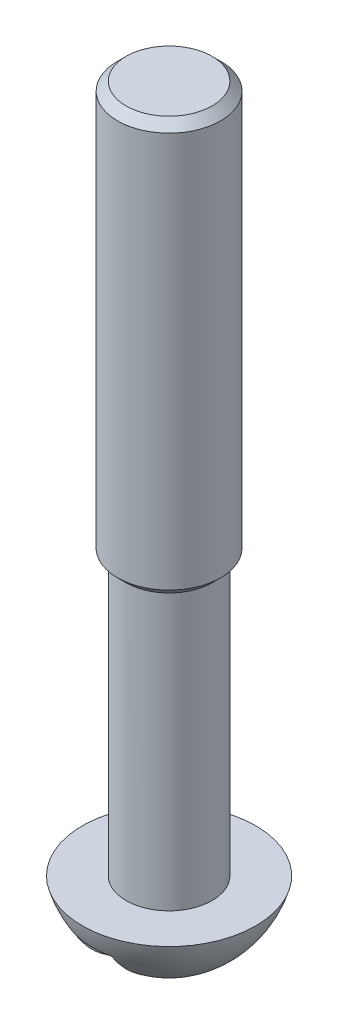
from build123d import *

# Parameters (mm, degrees)
SKETCH1_R               = 1.5
BOSS_EXTRUDE1_DEPTH     = 20
CUT_EXTRUDE1_DEPTH      = 21.315038789
CUT_EXTRUDE1_DEPTH_BACK = 21.315038789
SKETCH4_R               = 2.52
SKETCH4_R_2             = 1.25
CUT_EXTRUDE2_DEPTH      = 8
CHAMFER1_SIZE           = 0.25


with BuildPart() as part:
    # Sketch1 → Boss-Extrude1 (new body)
    with BuildSketch(Plane(origin=(0, 0, 0), x_dir=(1, 0, 0), z_dir=(0, 1, 0))):
        with Locations(Location((0, 0, 0), (0, 0, 270))):
            Circle(SKETCH1_R)
    extrude(amount=BOSS_EXTRUDE1_DEPTH)

    # Sketch2 → Revolve1 (revolve)
    with BuildSketch(Plane.XY, mode=Mode.PRIVATE) as revolve1_sk:
        with BuildLine():
            Line((0, 0), (-2.52, 0))
            ThreePointArc((-2.52, 0), (-1.585449748, -1.440539697), (0, -2.1))
            Line((0, -2.1), (0, 0))
        make_face()
    revolve(revolve1_sk.sketch.rotate(Axis((0, -2.1, 0), (0, 1, 0)), 180), axis=Axis((0, -2.1, 0), (0, 1, 0)))

    # Sketch3 → Cut-Extrude1 (cut, two sides: drawn at the far end of the back side and taken through both)
    with BuildSketch(Plane.XY.offset(-CUT_EXTRUDE1_DEPTH_BACK)):
        Polygon((-0.5, -0.7), (0, -0.7), (0.5, -0.7), (0.5, -4.6380618), (-0.5, -4.6380618), align=None)
    extrude(amount=CUT_EXTRUDE1_DEPTH + CUT_EXTRUDE1_DEPTH_BACK, mode=Mode.SUBTRACT)

    # Sketch4 → Cut-Extrude2 (cut)
    with BuildSketch(Plane(origin=(0, 0, 0), x_dir=(1, 0, 0), z_dir=(0, 1, 0))):
        Circle(SKETCH4_R)
        with Locations(Location((0, 0, 0), (0, 0, 180))):
            Circle(SKETCH4_R_2, mode=Mode.SUBTRACT)
    extrude(amount=CUT_EXTRUDE2_DEPTH, mode=Mode.SUBTRACT)

    # Chamfer1
    chamfer1_edges = [part.edges().sort_by_distance(p)[0] for p in [
        (0, 8, -1.5),
        (0, 20, -1.5),
    ]]
    chamfer(chamfer1_edges, length=CHAMFER1_SIZE - 0.0001)  # a hair under: the kernel refuses the full size


solid = part.part
